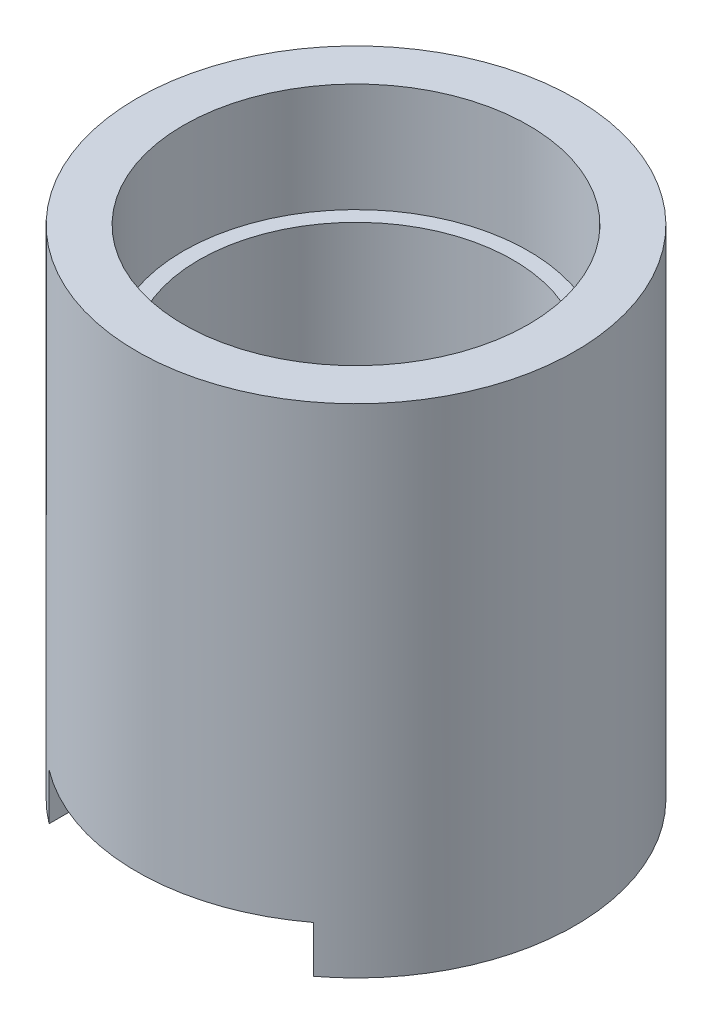
from build123d import *

# Parameters (mm, degrees)
ENL_V_MAT_EXTRU_1_DEPTH      = 38.704376404
ENL_V_MAT_EXTRU_1_DEPTH_BACK = 38.704376404
ESQUISSE2_W                  = 17
ESQUISSE2_H                  = 3
CHANFREIN1_SIZE              = 0.5
FILETAGE1_PITCH              = 0.7


with BuildPart() as part:
    # Esquisse1 → Révolution1 (revolve)
    with BuildSketch(Plane.XY):
        Polygon((-1.85, 0), (-1.85, 10), (-10.1, 10), (-10.1, 25), (-11.1, 25), (-11.1, 32), (-14.1, 32), (-14.1, 0), align=None)
    revolve(axis=Axis((0, 0, 0), (0, -1, 0)))

    # Esquisse2 → Enlèv. mat.-Extru.1 (cut, two sides: drawn at the far end of the back side and taken through both)
    with BuildSketch(Plane.XY.offset(-ENL_V_MAT_EXTRU_1_DEPTH_BACK)):
        with Locations((0, 1.5)):
            Rectangle(ESQUISSE2_W, ESQUISSE2_H)
    extrude(amount=ENL_V_MAT_EXTRU_1_DEPTH + ENL_V_MAT_EXTRU_1_DEPTH_BACK, mode=Mode.SUBTRACT)

    # Chanfrein1
    chanfrein1_edges = [part.edges().sort_by_distance(p)[0] for p in [
        (1.85, 3, 0),
    ]]
    chamfer(chanfrein1_edges, length=CHANFREIN1_SIZE)

    # Filetage1: the profile of Profil de filetage1 profile screwed along a right-hand helix of 11.428571 turns, 6 arcs to a turn; built about Z, then put on its axis
    filetage1_z = Axis((0, 0, 0), (0, 0, 1))
    filetage1_corners = [(1.8497, 0, -0.000173205), (2.228886112, 0, 0.218749999), (2.228886112, 0, 0.306249999), (1.8497, 0, 0.525173203)]
    with BuildLine(mode=Mode.PRIVATE) as filetage1_profile:
        Line(filetage1_corners[0], filetage1_corners[1])
        Line(filetage1_corners[1], filetage1_corners[2])
        Line(filetage1_corners[2], filetage1_corners[3])
        Line(filetage1_corners[3], filetage1_corners[0])
    filetage1_cap = Face(filetage1_profile.wire())
    filetage1_turn_angles = [0, 30, 60, 90, 120, 150, 180, 210, 240, 270, 300, 330, 360]
    filetage1_turn_weights = [1, 0.8660254037844387, 1, 0.8660254037844387, 1, 0.8660254037844387, 1, 0.8660254037844387, 1, 0.8660254037844387, 1, 0.8660254037844387, 1]
    filetage1_turn_rails = [Edge.make_bspline([Vector(p[0], p[1], 0).rotate(filetage1_z, filetage1_turn_angles[k]) / filetage1_turn_weights[k] + Vector(0, 0, p[2] + FILETAGE1_PITCH * filetage1_turn_angles[k] / 360) for k in range(13)], [0, 0, 0, 1, 1, 2, 2, 3, 3, 4, 4, 5, 5, 6, 6, 6], 2, filetage1_turn_weights) for p in filetage1_corners]
    filetage1_turn_sides = [Face.make_surface_from_curves(filetage1_turn_rails[p[0]], filetage1_turn_rails[p[1]]) for p in [(0, 1), (1, 2), (2, 3), (3, 0)]]
    filetage1_last_angles = [3960, 3990, 4020, 4050, 4080, 4097.142857143, 4114.285714286]
    filetage1_last_weights = [1, 0.8660254037844387, 1, 0.8660254037844387, 1, 0.9555728057861397, 1]
    filetage1_last_rails = [Edge.make_bspline([Vector(p[0], p[1], 0).rotate(filetage1_z, filetage1_last_angles[k]) / filetage1_last_weights[k] + Vector(0, 0, p[2] + FILETAGE1_PITCH * filetage1_last_angles[k] / 360) for k in range(7)], [0, 0, 0, 1, 1, 2, 2, 3, 3, 3], 2, filetage1_last_weights) for p in filetage1_corners]
    filetage1_last_sides = [Face.make_surface_from_curves(filetage1_last_rails[p[0]], filetage1_last_rails[p[1]]) for p in [(0, 1), (1, 2), (2, 3), (3, 0)]]
    filetage1 = Plane(origin=(0, 2, 0), x_dir=(1, 0, 0), z_dir=(0, 1, 0)) * Solid(Shell([*[p.moved(Location((0, 0, FILETAGE1_PITCH * i))) for i in range(11) for p in filetage1_turn_sides], *filetage1_last_sides, filetage1_cap, filetage1_cap.rotate(filetage1_z, 4114.285714286).moved(Location((0, 0, FILETAGE1_PITCH * 4114.285714286 / 360)))]))
    add(filetage1, mode=Mode.SUBTRACT)


solid = part.part
